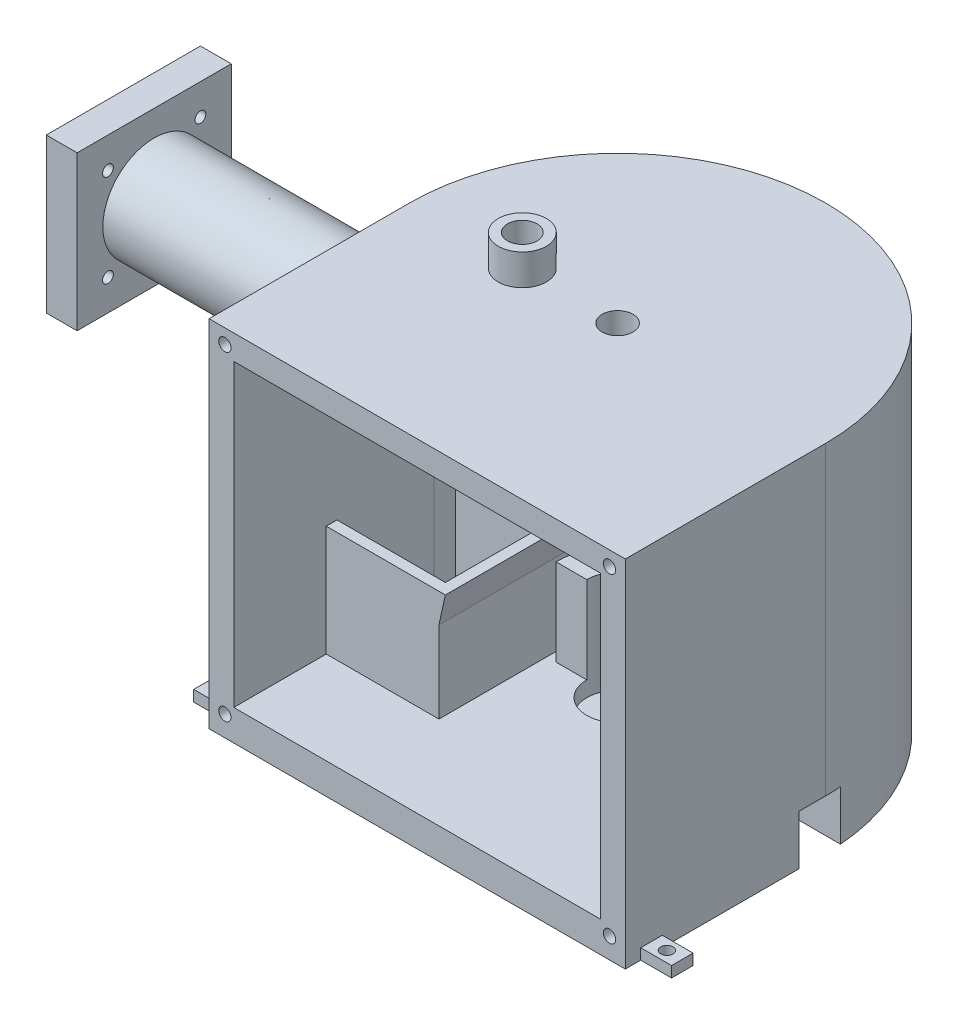
from build123d import *
from build123d.topology import SkipClean

# Parameters (mm, degrees)
BOSS_EXTRUDE3_DEPTH                   = 65
BOSS_EXTRUDE1_DEPTH                   = 6
BOSS_EXTRUDE1_DEPTH_BACK              = 6.25
SKETCH1_5_W                           = 6.6044296
SKETCH1_5_H                           = 19
SKETCH1_5_W_2                         = 10.945657065
BOSS_EXTRUDE2_START                   = -8.75
BOSS_EXTRUDE2_OUTLINE_W               = 40.850086665
BOSS_EXTRUDE2_OUTLINE_H               = 19
BOSS_EXTRUDE2_DEPTH                   = 2.5
REVOLVE2_ANGLE                        = 180
SKETCH1_12_W                          = 10
SKETCH1_12_H                          = 5
SKETCH1_11_W                          = 5
SKETCH1_11_H                          = 8
REVOLVE4_START                        = -10
REVOLVE4_DEPTH                        = 28.178366994
SKETCH3_6_W                           = 74.303654242
SKETCH3_6_H                           = 3.75
REVOLVE7_ANGLE                        = 180
SKETCH3_8_W                           = 18.503590934
SKETCH3_8_H                           = 2.3
SKETCH5_W                             = 50
SKETCH5_H                             = 50
SKETCH5_R                             = 16.65
BOSS_EXTRUDE4_DEPTH                   = 10
SKETCH6_R                             = 1.75
CAMERA_HEAT_SET_INSERT_CUT_DEPTH      = 34
SERVO_START                           = 67.5
SKETCH9_W                             = 13.671614749
SKETCH9_H                             = 17.273170498
SERVO_WIRE_CUT_DEPTH                  = 18.945657065
CUT_EXTRUDE2_DEPTH                    = 3.5
SKETCH10_4_W                          = 3
SKETCH10_4_H                          = 10.048090033
BOSS_EXTRUDE5_DEPTH                   = 35
BOSS_EXTRUDE5_DEPTH_BACK              = 10
BOSS_EXTRUDE6_START                   = 31.5
SKETCH11_3_W                          = 3.5
SKETCH11_3_H                          = 26.440435159
SKETCH11_3_W_2                        = 33.047923562
BOSS_EXTRUDE6_DEPTH                   = 3.5
BOSS_EXTRUDE7_START                   = -10
SKETCH11_5_W                          = 33.047923562
SKETCH11_5_H                          = 26.440435159
BOSS_EXTRUDE7_DEPTH                   = 3.5
SKETCH12_R                            = 2
HEAT_SET_INSERT_CUT_DEPTH             = 17
HEAT_SET_INSERT_CUT_DIRECTION_2_REACH = 205.302
SKETCH14_R                            = 2
PANEL_HEAT_SET_INSERT_CUT_DEPTH       = 10
SKETCH16_W                            = 7
SKETCH16_H                            = 3.57293467
BOSS_EXTRUDE10_DEPTH                  = 10
SKETCH18_W                            = 7
SKETCH18_H                            = 3.5
BOSS_EXTRUDE11_DEPTH                  = 10
SKETCH19_R                            = 2
CUT_EXTRUDE1_DEPTH                    = 213.271554907


# Read off the part's stored shape, not the designer's step: Boss-Extrude2, Revolve4
with BuildPart() as part:
    # Sketch4 → Boss-Extrude3 (new body)
    with BuildSketch(Plane.XY):
        Polygon((59.5, -10), (0, -10), (0, -15), (0, -20), (67.5, -20), (67.5, 95.198794821), (0, 95.198794821), (0, 87.198794821), (59.5, 87.198794821), align=None)
    boss_extrude3 = extrude(amount=BOSS_EXTRUDE3_DEPTH)

    # Mirror1: Boss-Extrude3 across plane
    add(boss_extrude3.mirror(Plane(origin=(0, 0, 0), x_dir=(0, 0, 1), z_dir=(1, 0, 0))))

    # Sketch1<5> → Boss-Extrude1 (add, two sides: drawn at the far end of the back side and taken through both)
    with BuildSketch(Plane.XY.offset(-BOSS_EXTRUDE1_DEPTH_BACK)):
        with Locations((21.952128135, -0.5)):
            Rectangle(SKETCH1_5_W, SKETCH1_5_H)
        with Locations((54.027171468, -0.5)):
            Rectangle(SKETCH1_5_W_2, SKETCH1_5_H)
    extrude(amount=BOSS_EXTRUDE1_DEPTH + BOSS_EXTRUDE1_DEPTH_BACK)

    # Boss-Extrude2 outline → Boss-Extrude2 (add)
    with BuildSketch(Plane.XY.offset(BOSS_EXTRUDE2_START)):
        with Locations((39.074956668, -0.5)):
            Rectangle(BOSS_EXTRUDE2_OUTLINE_W, BOSS_EXTRUDE2_OUTLINE_H)
    extrude(amount=BOSS_EXTRUDE2_DEPTH)

    # Sketch1 → Revolve2 (revolve)
    with BuildSketch(Plane.XY):
        Polygon((0, -15), (0, -20), (67.5, -20), (67.5, 95.198794821), (5, 95.198794821), (5, 87.198794821), (59.5, 87.198794821), (59.5, -10), (0, -10), align=None)
    revolve(axis=Axis((0, -1000, 0), (0, 1, 0)), revolution_arc=REVOLVE2_ANGLE)

    # Sketch1<12> → Cut-Revolve4 (revolve, cut)
    with BuildSketch(Plane.XY):
        with Locations((5, -12.5)):
            Rectangle(SKETCH1_12_W, SKETCH1_12_H)
    revolve(axis=Axis((0, -1000, 0), (0, 1, 0)), mode=Mode.SUBTRACT)

    # Sketch1<11> → Cut-Revolve2 (revolve, cut)
    with SkipClean():  # the faces are left unmerged after this step: merging them gives an invalid solid
        with BuildSketch(Plane.XY):
            with Locations((2.5, 91.198794821)):
                Rectangle(SKETCH1_11_W, SKETCH1_11_H)
        revolve(axis=Axis((0, -1000, 0), (0, 1, 0)), mode=Mode.SUBTRACT)

    # Revolve4 outline → Revolve4 (add)
    with SkipClean():  # the faces are left unmerged after this step: merging them gives an invalid solid
        with BuildSketch(Plane(origin=(0, 0, 0), x_dir=(1, 0, 0), z_dir=(0, 1, 0)).offset(REVOLVE4_START)):
            with BuildLine():
                ThreePointArc((-10, 0), (0, 10), (10, 0))
                Line((10, 0), (20, 0))
                ThreePointArc((20, 0), (0, 20), (-20, 0))
                Line((-20, 0), (-10, 0))
            make_face()
        extrude(amount=REVOLVE4_DEPTH)

    # Sketch3 → Cut-Revolve1 (revolve, cut)
    with SkipClean():  # the faces are left unmerged after this step: merging them gives an invalid solid
        with BuildSketch(Plane.XY):
            Polygon((-49.874960718, 68.314577929), (-59.5, 68.314577929), (-67.5, 68.314577929), (-83.969434571, 68.314577929), (-83.969434571, 55.414577929), (-74.368322949, 55.414577929), (-58.243601064, 55.414577929), (-49.874960718, 55.414577929), align=None)
        revolve(axis=Axis((-74.368322949, 55.414577929, 0), (1, 0, 0)), mode=Mode.SUBTRACT)

    # Sketch3<6> → Revolve6 (revolve)
    with SkipClean():  # the faces are left unmerged after this step: merging them gives an invalid solid
        with BuildSketch(Plane.XY, mode=Mode.PRIVATE) as revolve6_sk:
            with Locations((-104.651827121, 70.189577929)):
                Rectangle(SKETCH3_6_W, SKETCH3_6_H)
            Polygon((-59.5, 69.064577929), (-59.5, 68.314577929), (-67.5, 68.314577929), (-67.5, 72.064577929), (-59.5, 72.064577929), align=None)
        revolve(revolve6_sk.sketch.rotate(Axis((-74.368322949, 55.414577929, 0), (1, 0, 0)), 90), axis=Axis((-74.368322949, 55.414577929, 0), (1, 0, 0)))

    # Sketch3<7> → Revolve7 (revolve, symmetric)
    with SkipClean():  # the faces are left unmerged after this step: merging them gives an invalid solid
        with BuildSketch(Plane.XY) as revolve7_sk:
            Polygon((-39.5, 69.064577929), (-59.5, 69.064577929), (-59.5, 68.314577929), (-49.874960718, 68.314577929), (-41.5, 68.314577929), (-41.5, 63.762019978), (-39.5, 63.762019978), align=None)
        revolve(axis=Axis((-74.368322949, 55.414577929, 0), (1, 0, 0)), revolution_arc=REVOLVE7_ANGLE / 2)
        revolve(revolve7_sk.sketch, axis=Axis((-74.368322949, 55.414577929, 0), (-1, 0, 0)), revolution_arc=REVOLVE7_ANGLE / 2)

    # Sketch3<8> → Revolve8 (revolve)
    with SkipClean():  # the faces are left unmerged after this step: merging them gives an invalid solid
        with BuildSketch(Plane.XY, mode=Mode.PRIVATE) as revolve8_sk:
            with Locations((-151.055449709, 70.914577929)):
                Rectangle(SKETCH3_8_W, SKETCH3_8_H)
        revolve(revolve8_sk.sketch.rotate(Axis((-74.368322949, 55.414577929, 0), (1, 0, 0)), 90), axis=Axis((-74.368322949, 55.414577929, 0), (1, 0, 0)))

    # Sketch5 → Boss-Extrude4 (add)
    with SkipClean():  # the faces are left unmerged after this step: merging them gives an invalid solid
        with BuildSketch(Plane.ZY.offset(160.307245176)):
            with Locations((0, 55.39707409)):
                Rectangle(SKETCH5_W, SKETCH5_H)
            with Locations((0, 55.414577929)):
                Circle(SKETCH5_R, mode=Mode.SUBTRACT)
        extrude(amount=-BOSS_EXTRUDE4_DEPTH)

    # Sketch6 → Camera Heat Set Insert Cut (cut)
    with SkipClean():  # the faces are left unmerged after this step: merging them gives an invalid solid
        with BuildSketch(Plane.ZY.offset(160.307245176)):
            with Locations((15, 70.414577929)):
                Circle(SKETCH6_R)
            with Locations((-15, 70.414577929)):
                Circle(SKETCH6_R)
            with Locations((-15, 40.414577929)):
                Circle(SKETCH6_R)
            with Locations((15, 40.414577929)):
                Circle(SKETCH6_R)
        extrude(amount=-CAMERA_HEAT_SET_INSERT_CUT_DEPTH, mode=Mode.SUBTRACT)

    # Sketch9 → Servo Wire Cut (cut)
    with BuildSketch(Plane(origin=(0, 0, 0), x_dir=(0, 0, -1), z_dir=(1, 0, 0)).offset(SERVO_START)):
        with Locations((-1.860269854, -12.475825554)):
            Rectangle(SKETCH9_W, SKETCH9_H)
    extrude(amount=-SERVO_WIRE_CUT_DEPTH, mode=Mode.SUBTRACT)

    # Sketch1<13> → Cut-Extrude2 (cut, symmetric)
    with BuildSketch(Plane.XY):
        Polygon((22.754342935, -12.920336749), (59.5, -12.920336749), (59.5, -10), (25.254342935, -10), (25.254342935, 9), (22.754342935, 9), align=None)
    extrude(amount=CUT_EXTRUDE2_DEPTH, both=True, mode=Mode.SUBTRACT)

    # Sketch10 → Cut-Revolve3 (revolve, cut)
    with BuildSketch(Plane(origin=(0, 0, 0), x_dir=(-1, 0, 0), z_dir=(0, 0, -1)), mode=Mode.PRIVATE) as cut_revolve3_sk:
        Polygon((30.91, 95.198794821), (35.71, 95.198794821), (33.71, 87.198794821), (30.91, 87.198794821), align=None)
        Polygon((30.91, 87.198794821), (30.91, 95.198794821), (35.71, 95.198794821), (33.71, 87.198794821), align=None)
    revolve(cut_revolve3_sk.sketch.rotate(Axis((-30.91, -903.341461843, 0), (0, 1, 0)), 270), axis=Axis((-30.91, -903.341461843, 0), (0, 1, 0)), mode=Mode.SUBTRACT)

    # Sketch10<4> → Tubing insert New (revolve)
    with SkipClean():  # the faces are left unmerged after this step: merging them gives an invalid solid
        with BuildSketch(Plane(origin=(0, 0, 0), x_dir=(-1, 0, 0), z_dir=(0, 0, -1)), mode=Mode.PRIVATE) as tubing_insert_new_sk:
            with Locations((37.21, 100.222839838)):
                Rectangle(SKETCH10_4_W, SKETCH10_4_H)
            Polygon((33.71, 87.198794821), (32.71, 82.301377514), (34.71, 82.301377514), (35.71, 87.198794821), align=None)
        revolve(tubing_insert_new_sk.sketch.rotate(Axis((-30.91, -903.341461843, 0), (0, 1, 0)), 270), axis=Axis((-30.91, -903.341461843, 0), (0, 1, 0)))
    add(part.part.scale(1), mode=Mode.REPLACE)  # the faces are merged on a copy

    # Sketch11 → Boss-Extrude5 (add, two sides: drawn at the far end of the back side and taken through both)
    with BuildSketch(Plane.XY.offset(-BOSS_EXTRUDE5_DEPTH_BACK)):
        Polygon((-24.357370462, 25.916670518), (-26.452076438, 16.440435159), (-26.452076438, -10), (-22.952076438, -10), (-22.952076438, 16.440435159), (-20.857370462, 25.916670518), align=None)
    extrude(amount=BOSS_EXTRUDE5_DEPTH + BOSS_EXTRUDE5_DEPTH_BACK)

    # Sketch11<3> → Boss-Extrude6 (add)
    with BuildSketch(Plane.XY.offset(BOSS_EXTRUDE6_START)):
        Polygon((-26.452076438, 16.440435159), (-22.952076438, 16.440435159), (-20.857370462, 25.916670518), (-24.357370462, 25.916670518), align=None)
        with Locations((-24.702076438, 3.220217579)):
            Rectangle(SKETCH11_3_W, SKETCH11_3_H)
        Polygon((-59.5, 16.440435159), (-26.452076438, 16.440435159), (-24.357370462, 25.916670518), (-59.5, 25.916670518), align=None)
        with Locations((-42.976038219, 3.220217579)):
            Rectangle(SKETCH11_3_W_2, SKETCH11_3_H)
    extrude(amount=BOSS_EXTRUDE6_DEPTH)

    # Sketch11<5> → Boss-Extrude7 (add)
    with SkipClean():  # the faces are left unmerged after this step: merging them gives an invalid solid
        with BuildSketch(Plane.XY.offset(BOSS_EXTRUDE7_START)):
            with Locations((-42.976038219, 3.220217579)):
                Rectangle(SKETCH11_5_W, SKETCH11_5_H)
            Polygon((-59.5, 16.440435159), (-26.452076438, 16.440435159), (-24.357370462, 25.916670518), (-59.5, 25.916670518), align=None)
        extrude(amount=BOSS_EXTRUDE7_DEPTH)

    # Sketch12 → Heat Set Insert Cut (cut)
    with SkipClean():  # the faces are left unmerged after this step: merging them gives an invalid solid
        with BuildSketch(Plane.XY):
            with Locations(Location((54.027171468, 2.884785525, 0), (0, 0, 180))):
                Circle(SKETCH12_R)
            with Locations(Location((15, 2.884785525, 0), (0, 0, 180))):
                Circle(SKETCH12_R)
        extrude(amount=-HEAT_SET_INSERT_CUT_DEPTH, mode=Mode.SUBTRACT)

    # Heat Set Insert Cut direction 2: up to this face of the body (flat: up to its plane)
    heat_set_insert_cut_direction_2_end = Plane(part.part.faces().sort_by_distance((54.027171468, 2.580379847, 6))[0])
    # Sketch12 → Heat Set Insert Cut direction 2 (cut, up to the picked face)
    with BuildSketch(Plane.XY, mode=Mode.PRIVATE) as heat_set_insert_cut_direction_2_sk1:
        with Locations(Location((54.027171468, 2.884785525, 0), (0, 0, 180))):
            Circle(SKETCH12_R)
    heat_set_insert_cut_direction_2_tool1 = split(extrude(heat_set_insert_cut_direction_2_sk1.sketch, amount=HEAT_SET_INSERT_CUT_DIRECTION_2_REACH, mode=Mode.PRIVATE), bisect_by=heat_set_insert_cut_direction_2_end, keep=Keep.BOTH, mode=Mode.PRIVATE)
    # Sketch12 → Heat Set Insert Cut direction 2 (cut, up to the picked face)
    with BuildSketch(Plane.XY, mode=Mode.PRIVATE) as heat_set_insert_cut_direction_2_sk2:
        with Locations(Location((15, 2.884785525, 0), (0, 0, 180))):
            Circle(SKETCH12_R)
    heat_set_insert_cut_direction_2_tool2 = split(extrude(heat_set_insert_cut_direction_2_sk2.sketch, amount=HEAT_SET_INSERT_CUT_DIRECTION_2_REACH, mode=Mode.PRIVATE), bisect_by=heat_set_insert_cut_direction_2_end, keep=Keep.BOTH, mode=Mode.PRIVATE)
    add(heat_set_insert_cut_direction_2_tool1.solids().sort_by(Axis((54.027171, 2.884786, 0), (0, 0, 1)))[0], mode=Mode.SUBTRACT)
    add(heat_set_insert_cut_direction_2_tool2.solids().sort_by(Axis((15, 2.884786, 0), (0, 0, 1)))[0], mode=Mode.SUBTRACT)

    # Sketch14 → Panel Heat Set Insert Cut (cut)
    with BuildSketch(Plane.XY.offset(65)):
        with Locations((-62.379754231, 90.491593885)):
            Circle(SKETCH14_R)
        with Locations((62.379754231, 90.491593885)):
            Circle(SKETCH14_R)
        with Locations((62.379754231, -13.292799065)):
            Circle(SKETCH14_R)
        with Locations((-62.379754231, -13.292799065)):
            Circle(SKETCH14_R)
    extrude(amount=-PANEL_HEAT_SET_INSERT_CUT_DEPTH, mode=Mode.SUBTRACT)

    # Sketch16 → Boss-Extrude10 (add)
    with BuildSketch(Plane.ZY.offset(67.5)):
        with Locations((3.5, -18.213532665)):
            Rectangle(SKETCH16_W, SKETCH16_H)
        with Locations((56.5, -18.213532665)):
            Rectangle(SKETCH16_W, SKETCH16_H)
    extrude(amount=BOSS_EXTRUDE10_DEPTH)

    # Sketch18 → Boss-Extrude11 (add)
    with BuildSketch(Plane(origin=(67.5, 0, 0), x_dir=(0, 0, -1), z_dir=(1, 0, 0))):
        with Locations((-56.5, -18.25)):
            Rectangle(SKETCH18_W, SKETCH18_H)
    extrude(amount=BOSS_EXTRUDE11_DEPTH)

    # Sketch19 → Cut-Extrude1 (cut, through all)
    with BuildSketch(Plane(origin=(0, -16.42706533, 0), x_dir=(1, 0, 0), z_dir=(0, 1, 0))):
        with Locations(Location((-72.5, -56.5, 0), (0, 0, 180))):
            Circle(SKETCH19_R)
        with Locations(Location((-72.5, -3.5, 0), (0, 0, 180))):
            Circle(SKETCH19_R)
        with Locations(Location((72.5, -56.5, 0), (0, 0, 180))):
            Circle(SKETCH19_R)
    extrude(amount=-CUT_EXTRUDE1_DEPTH, mode=Mode.SUBTRACT)


solid = part.part
